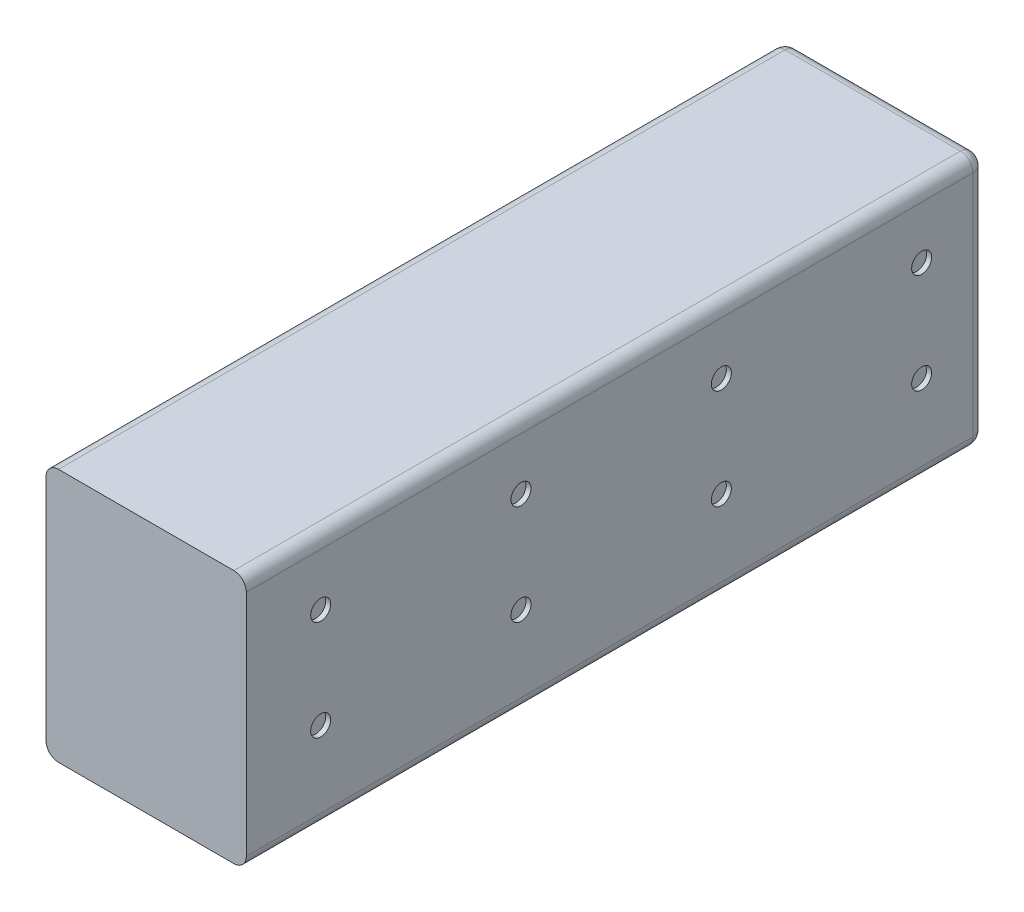
from build123d import *

# Parameters (mm, degrees)
SKETCH2_W           = 80
SKETCH2_H           = 101.346
BOSS_EXTRUDE1_DEPTH = 295.148
SKETCH3_R           = 4
CUT_EXTRUDE1_DEPTH  = 2
FILLET3_R           = 5
FILLET4_R           = 5
FILLET5_R           = 5
FILLET6_R           = 5
FILLET2_R           = 5


with BuildPart() as part:
    # Sketch2 → Boss-Extrude1 (new body)
    with BuildSketch(Plane.XY):
        with Locations((40, 50.673)):
            Rectangle(SKETCH2_W, SKETCH2_H)
    extrude(amount=BOSS_EXTRUDE1_DEPTH)

    # Sketch3 → Cut-Extrude1 (cut)
    with BuildSketch(Plane(origin=(80, 0, 0), x_dir=(0, 0, -1), z_dir=(1, 0, 0))):
        with Locations((-265.445597479, 75.450765932)):
            Circle(SKETCH3_R)
        with Locations((-185.445597479, 75.450765932)):
            Circle(SKETCH3_R)
        with Locations((-105.445597479, 75.450765932)):
            Circle(SKETCH3_R)
        with Locations((-25.445597479, 75.450765932)):
            Circle(SKETCH3_R)
        with Locations((-185.445597479, 35.450765932)):
            Circle(SKETCH3_R)
        with Locations((-105.445597479, 35.450765932)):
            Circle(SKETCH3_R)
        with Locations((-25.445597479, 35.450765932)):
            Circle(SKETCH3_R)
        with Locations((-265.445597479, 35.450765932)):
            Circle(SKETCH3_R)
    cut_extrude1 = extrude(amount=-CUT_EXTRUDE1_DEPTH, mode=Mode.SUBTRACT)

    # Mirror1: Cut-Extrude1 across plane
    add(cut_extrude1.mirror(Plane.ZY.offset(-40)), mode=Mode.SUBTRACT)

    # Fillet3
    fillet3_edges = [part.edges().sort_by_distance(p)[0] for p in [
        (0, 101.346, 147.574),
    ]]
    fillet(fillet3_edges, radius=FILLET3_R)

    # Fillet4
    fillet4_edges = [part.edges().sort_by_distance(p)[0] for p in [
        (80, 101.346, 147.574),
    ]]
    fillet(fillet4_edges, radius=FILLET4_R)

    # Fillet5
    fillet5_edges = [part.edges().sort_by_distance(p)[0] for p in [
        (0, 0, 147.574),
    ]]
    fillet(fillet5_edges, radius=FILLET5_R)

    # Fillet6
    fillet6_edges = [part.edges().sort_by_distance(p)[0] for p in [
        (80, 0, 147.574),
    ]]
    fillet(fillet6_edges, radius=FILLET6_R)

    # Fillet2
    fillet2_edges = [part.edges().sort_by_distance(p)[0] for p in [
        (40, 0, 0),
        (80, 50.673, 0),
        (0, 50.673, 0),
        (40, 101.346, 0),
        (78.535533906, 99.881533906, 0),
        (78.535533906, 1.464466094, 0),
        (1.464466094, 1.464466094, 0),
        (1.464466094, 99.881533906, 0),
    ]]
    fillet(fillet2_edges, radius=FILLET2_R)


solid = part.part
